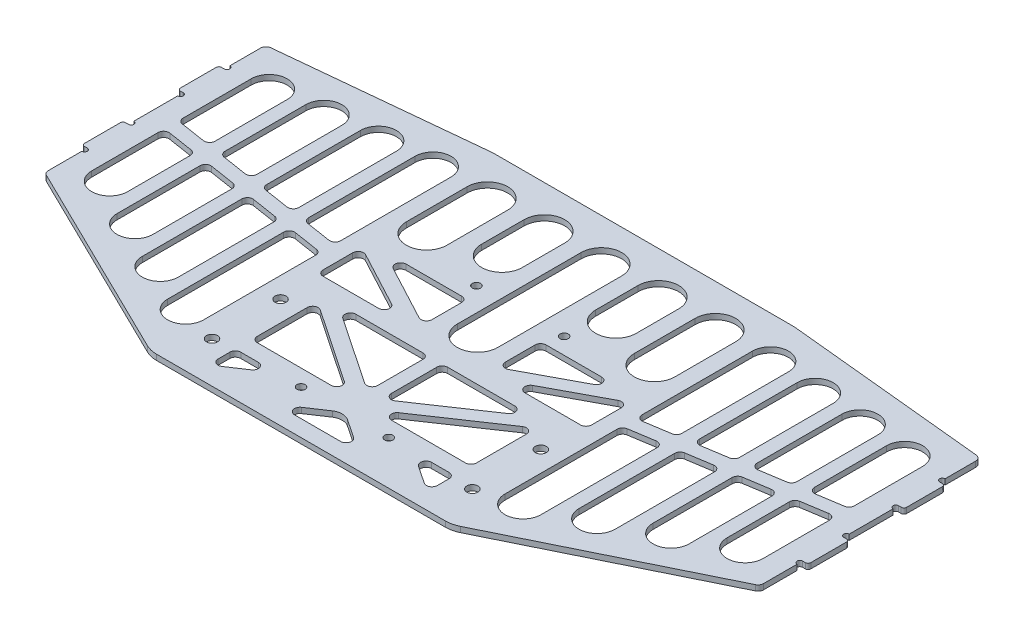
from build123d import *

# Parameters (mm, degrees)
SKETCH_1_R          = 2
SKETCH_1_R_2        = 1.5
EXTRUDE_1_DEPTH     = 2
SKETCH_3_R          = 1
CUT_EXTRUDE_1_DEPTH = 3
SKETCH_4_W          = 80
SKETCH_4_H          = 27
SKETCH_4_W_2        = 35.6
SKETCH_4_H_2        = 19
CUT_EXTRUDE_2_DEPTH = 183.168191515
EXTRUDE_START       = -2
EXTRUDE_2_DEPTH     = 2
FILLET_1_R          = 2
FILLET_2_R          = 5
FILLET_3_R          = 10
FILLET_4_R          = 1
FILLET_5_R          = 30


# Read off the part's stored shape, not the designer's step: 拉伸-薄壁2
with BuildPart() as part:
    # 草图1 → 凸台-拉伸1 (new body)
    with BuildSketch(Plane(origin=(0, 0, 0), x_dir=(1, 0, 0), z_dir=(0, 1, 0))):
        Polygon((-55, 0), (55, 0), (130.5, 37), (130.5, 52.5), (132.5, 52.5), (132.5, 67.5), (130.5, 67.5), (130.5, 87.5), (132.5, 87.5), (132.5, 102.5), (130.5, 102.5), (130.5, 117.5), (55, 125), (-55, 125), (-130.5, 117.5), (-130.5, 102.5), (-132.5, 102.5), (-132.5, 87.5), (-130.5, 87.5), (-130.5, 67.5), (-132.5, 67.5), (-132.5, 52.5), (-130.5, 52.5), (-130.5, 37), align=None)
        with Locations(Location((-47.5, 40, 0), (0, 0, 270))):
            Circle(SKETCH_1_R, mode=Mode.SUBTRACT)
        with Locations(Location((-47.5, 15, 0), (0, 0, 270))):
            Circle(SKETCH_1_R, mode=Mode.SUBTRACT)
        with Locations(Location((47.5, 40, 0), (0, 0, 90))):
            Circle(SKETCH_1_R, mode=Mode.SUBTRACT)
        with Locations(Location((47.5, 15, 0), (0, 0, 90))):
            Circle(SKETCH_1_R, mode=Mode.SUBTRACT)
        with Locations(Location((-16, 80, 0), (0, 0, 270))):
            Circle(SKETCH_1_R_2, mode=Mode.SUBTRACT)
        with Locations(Location((-16, 16, 0), (0, 0, 270))):
            Circle(SKETCH_1_R_2, mode=Mode.SUBTRACT)
        with Locations(Location((16, 16, 0), (0, 0, 90))):
            Circle(SKETCH_1_R_2, mode=Mode.SUBTRACT)
        with Locations(Location((16, 80, 0), (0, 0, 90))):
            Circle(SKETCH_1_R_2, mode=Mode.SUBTRACT)
    extrude(amount=EXTRUDE_1_DEPTH)

    # 草图3 → 切除-拉伸1 (cut)
    with BuildSketch(Plane(origin=(0, 2, 0), x_dir=(1, 0, 0), z_dir=(0, 1, 0))):
        with Locations((-130.5, 86.5)):
            Circle(SKETCH_3_R)
        with Locations((-130.5, 103.5)):
            Circle(SKETCH_3_R)
        with Locations((-130.5, 68.5)):
            Circle(SKETCH_3_R)
        with Locations((-130.5, 51.5)):
            Circle(SKETCH_3_R)
        with Locations((130.5, 51.5)):
            Circle(SKETCH_3_R)
        with Locations((130.5, 68.5)):
            Circle(SKETCH_3_R)
        with Locations((130.5, 103.5)):
            Circle(SKETCH_3_R)
        with Locations((130.5, 86.5)):
            Circle(SKETCH_3_R)
    extrude(amount=-CUT_EXTRUDE_1_DEPTH, mode=Mode.SUBTRACT)

    # 草图4 → 切除-拉伸2 (cut, through all)
    with BuildSketch(Plane(origin=(0, 2, 0), x_dir=(1, 0, 0), z_dir=(0, 1, 0))):
        Polygon((0, 16), (-15, 6), (15, 6), align=None)
        Polygon((-40, 16), (-40, 6), (-25, 16), align=None)
        with Locations((0, 35.5)):
            Rectangle(SKETCH_4_W, SKETCH_4_H)
        Polygon((25, 16), (40, 16), (40, 6), align=None)
        with BuildLine():
            Line((-91.25, 106.112927747), (-91.25, 37.19815221))
            ThreePointArc((-91.25, 37.19815221), (-97.8125, 30.63565221), (-104.375, 37.19815221))
            Line((-104.375, 37.19815221), (-104.375, 106.112927747))
            ThreePointArc((-104.375, 106.112927747), (-97.8125, 112.675427747), (-91.25, 106.112927747))
        make_face()
        with BuildLine():
            Line((-73.125, 107.913424436), (-73.125, 28.315701878))
            ThreePointArc((-73.125, 28.315701878), (-79.6875, 21.753201878), (-86.25, 28.315701878))
            Line((-86.25, 28.315701878), (-86.25, 107.913424436))
            ThreePointArc((-86.25, 107.913424436), (-79.6875, 114.475924436), (-73.125, 107.913424436))
        make_face()
        with BuildLine():
            Line((-55, 109.713921125), (-55, 19.433251547))
            ThreePointArc((-55, 19.433251547), (-61.5625, 12.870751547), (-68.125, 19.433251547))
            Line((-68.125, 19.433251547), (-68.125, 109.713921125))
            ThreePointArc((-68.125, 109.713921125), (-61.5625, 116.276421125), (-55, 109.713921125))
        make_face()
        with BuildLine():
            Line((-109.375, 104.312431059), (-109.375, 46.080602541))
            ThreePointArc((-109.375, 46.080602541), (-115.9375, 39.518102541), (-122.5, 46.080602541))
            Line((-122.5, 46.080602541), (-122.5, 104.312431059))
            ThreePointArc((-122.5, 104.312431059), (-115.9375, 110.874931059), (-109.375, 104.312431059))
        make_face()
        with Locations((-31.2, 64.5)):
            Rectangle(SKETCH_4_W_2, SKETCH_4_H_2)
        with BuildLine():
            Line((-34.2, 109.6), (-34.2, 87.4))
            ThreePointArc((-34.2, 87.4), (-41.6, 80), (-49, 87.4))
            Line((-49, 87.4), (-49, 109.6))
            ThreePointArc((-49, 109.6), (-41.6, 117), (-34.2, 109.6))
        make_face()
        with BuildLine():
            Line((-13.4, 109.6), (-13.4, 94.105672618))
            ThreePointArc((-13.4, 94.105672618), (-20.8, 86.705672618), (-28.2, 94.105672618))
            Line((-28.2, 94.105672618), (-28.2, 109.6))
            ThreePointArc((-28.2, 109.6), (-20.8, 117), (-13.4, 109.6))
        make_face()
        with BuildLine():
            Line((7.4, 109.6), (7.4, 64.4))
            ThreePointArc((7.4, 64.4), (0, 57), (-7.4, 64.4))
            Line((-7.4, 64.4), (-7.4, 109.6))
            ThreePointArc((-7.4, 109.6), (0, 117), (7.4, 109.6))
        make_face()
        with Locations((31.2, 64.5)):
            Rectangle(SKETCH_4_W_2, SKETCH_4_H_2)
        with BuildLine():
            Line((13.4, 109.6), (13.4, 94.105672618))
            ThreePointArc((13.4, 94.105672618), (20.8, 86.705672618), (28.2, 94.105672618))
            Line((28.2, 94.105672618), (28.2, 109.6))
            ThreePointArc((28.2, 109.6), (20.8, 117), (13.4, 109.6))
        make_face()
        with BuildLine():
            Line((34.2, 109.6), (34.2, 87.4))
            ThreePointArc((34.2, 87.4), (41.6, 80), (49, 87.4))
            Line((49, 87.4), (49, 109.6))
            ThreePointArc((49, 109.6), (41.6, 117), (34.2, 109.6))
        make_face()
        with BuildLine():
            Line((109.375, 104.312431059), (109.375, 46.080602541))
            ThreePointArc((109.375, 46.080602541), (115.9375, 39.518102541), (122.5, 46.080602541))
            Line((122.5, 46.080602541), (122.5, 104.312431059))
            ThreePointArc((122.5, 104.312431059), (115.9375, 110.874931059), (109.375, 104.312431059))
        make_face()
        with BuildLine():
            Line((55, 109.713921125), (55, 19.433251547))
            ThreePointArc((55, 19.433251547), (61.5625, 12.870751547), (68.125, 19.433251547))
            Line((68.125, 19.433251547), (68.125, 109.713921125))
            ThreePointArc((68.125, 109.713921125), (61.5625, 116.276421125), (55, 109.713921125))
        make_face()
        with BuildLine():
            Line((73.125, 107.913424436), (73.125, 28.315701878))
            ThreePointArc((73.125, 28.315701878), (79.6875, 21.753201878), (86.25, 28.315701878))
            Line((86.25, 28.315701878), (86.25, 107.913424436))
            ThreePointArc((86.25, 107.913424436), (79.6875, 114.475924436), (73.125, 107.913424436))
        make_face()
        with BuildLine():
            Line((91.25, 106.112927747), (91.25, 37.19815221))
            ThreePointArc((91.25, 37.19815221), (97.8125, 30.63565221), (104.375, 37.19815221))
            Line((104.375, 37.19815221), (104.375, 106.112927747))
            ThreePointArc((104.375, 106.112927747), (97.8125, 112.675427747), (91.25, 106.112927747))
        make_face()
    extrude(amount=-CUT_EXTRUDE_2_DEPTH, mode=Mode.SUBTRACT)

    # 拉伸-薄壁2 outline → 拉伸-薄壁2 (add)
    with BuildSketch(Plane(origin=(0, 2, 0), x_dir=(1, 0, 0), z_dir=(0, 1, 0)).offset(EXTRUDE_START)):
        Polygon((13.4, 55), (18.709597749, 55), (49, 71.166225921), (49, 74), (43.690402251, 74), (13.4, 57.833774079), align=None)
        Polygon((-13.4, 55), (-13.4, 57.833774079), (-43.690402251, 74), (-49, 74), (-49, 71.166225921), (-18.709597749, 55), align=None)
        Polygon((-104.375, 74.874833192), (-104.375, 69.813293306), (-91.25, 67.747723494), (-91.25, 72.80926338), align=None)
        Polygon((-122.5, 77.727286743), (-122.5, 72.665746857), (-109.375, 70.600177044), (-109.375, 75.66171693), align=None)
        Polygon((-68.125, 69.169926091), (-68.125, 64.108386205), (-55, 62.042816393), (-55, 67.104356279), align=None)
        Polygon((-86.25, 72.022379642), (-86.25, 66.960839756), (-73.125, 64.895269943), (-73.125, 69.956809829), align=None)
        Polygon((122.5, 72.665746857), (122.5, 77.727286743), (109.375, 75.66171693), (109.375, 70.600177044), align=None)
        Polygon((68.125, 64.108386205), (68.125, 69.169926091), (55, 67.104356279), (55, 62.042816393), align=None)
        Polygon((86.25, 66.960839756), (86.25, 72.022379642), (73.125, 69.956809829), (73.125, 64.895269943), align=None)
        Polygon((104.375, 69.813293306), (104.375, 74.874833192), (91.25, 72.80926338), (91.25, 67.747723494), align=None)
        Polygon((35.531507959, 49), (2.5, 26.703732128), (2.5, 49), (-2.5, 49), (-2.5, 26.703732128), (-35.531507959, 49), (-40, 49), (-40, 45.983767872), (-4.468492041, 22), (4.468492041, 22), (40, 45.983767872), (40, 49), align=None)
    extrude(amount=EXTRUDE_2_DEPTH)

    # 圆角1
    fillet_1_edges = [part.edges().sort_by_distance(p)[0] for p in [
        (13.4, 1, -74),
        (49, 1, -55),
        (-40, 1, -16),
        (-25, 1, -16),
        (-40, 1, -6),
        (15, 1, -6),
        (-15, 1, -6),
        (-49, 1, -55),
        (-13.4, 1, -74),
        (40, 1, -6),
        (25, 1, -16),
        (40, 1, -16),
        (-40, 1, -22),
        (40, 1, -22),
        (130.5, 1, -117.5),
        (130.5, 1, -37),
        (-130.5, 1, -37),
        (-130.5, 1, -117.5),
        (13.4, 1, -57.833774079),
        (18.709597749, 1, -55),
        (49, 1, -71.166225921),
        (43.690402251, 1, -74),
        (-18.709597749, 1, -55),
        (-13.4, 1, -57.833774079),
        (-43.690402251, 1, -74),
        (-49, 1, -71.166225921),
        (-104.375, 1, -69.813293306),
        (-104.375, 1, -74.874833192),
        (-73.125, 1, -69.956809829),
        (-86.25, 1, -72.022379642),
        (-55, 1, -67.104356279),
        (-68.125, 1, -69.169926091),
        (-109.375, 1, -75.66171693),
        (-122.5, 1, -77.727286743),
        (-91.25, 1, -72.80926338),
        (-73.125, 1, -64.895269943),
        (-68.125, 1, -64.108386205),
        (-55, 1, -62.042816393),
        (-109.375, 1, -70.600177044),
        (-86.25, 1, -66.960839756),
        (-91.25, 1, -67.747723494),
        (-122.5, 1, -72.665746857),
        (109.375, 1, -75.66171693),
        (109.375, 1, -70.600177044),
        (104.375, 1, -69.813293306),
        (91.25, 1, -67.747723494),
        (86.25, 1, -66.960839756),
        (73.125, 1, -64.895269943),
        (68.125, 1, -64.108386205),
        (55, 1, -62.042816393),
        (122.5, 1, -72.665746857),
        (104.375, 1, -74.874833192),
        (91.25, 1, -72.80926338),
        (86.25, 1, -72.022379642),
        (73.125, 1, -69.956809829),
        (68.125, 1, -69.169926091),
        (122.5, 1, -77.727286743),
        (55, 1, -67.104356279),
        (-4.468492041, 1, -22),
        (4.468492041, 1, -22),
        (-35.531507959, 1, -49),
        (35.531507959, 1, -49),
        (-2.5, 1, -26.703732128),
        (40, 1, -45.983767872),
        (-40, 1, -45.983767872),
        (2.5, 1, -26.703732128),
        (2.5, 1, -49),
        (-2.5, 1, -49),
    ]]
    fillet(fillet_1_edges, radius=FILLET_1_R)

    # 圆角2
    fillet_2_edges = [part.edges().sort_by_distance(p)[0] for p in [
        (0, 1, -16),
    ]]
    fillet(fillet_2_edges, radius=FILLET_2_R)

    # 圆角3
    fillet_3_edges = [part.edges().sort_by_distance(p)[0] for p in [
        (55, 1, 0),
        (-55, 1, 0),
    ]]
    fillet(fillet_3_edges, radius=FILLET_3_R)

    # 圆角4
    fillet_4_edges = [part.edges().sort_by_distance(p)[0] for p in [
        (132.5, 1, -102.5),
        (132.5, 1, -87.5),
        (132.5, 1, -67.5),
        (132.5, 1, -52.5),
        (-132.5, 1, -52.5),
        (-132.5, 1, -67.5),
        (-132.5, 1, -87.5),
        (-132.5, 1, -102.5),
    ]]
    fillet(fillet_4_edges, radius=FILLET_4_R)

    # 圆角5
    # the kernel refuses this fillet: 30 mm, written as the material it takes off along each edge
    with BuildSketch(Plane(origin=(-55, -3.716020656, -125), x_dir=(-0.9951022246073864, 0, 0.09885121436497732), z_dir=(0, 1, 0)), Plane(origin=(55, -3.716020656, -125), x_dir=(-1, 0, 0), z_dir=(0, 1, 0))) as fillet_5_piece_1:
        with BuildLine():
            CenterArc((FILLET_5_R * 0.0495469420793, FILLET_5_R), FILLET_5_R, 264.32697786, 5.67302214)
            Line((-FILLET_5_R * 0.0493042722856, FILLET_5_R * 0.00489777539261), (0, 0))
            Line((0, 0), (FILLET_5_R * 0.0495469420793, 0))
        make_face()
    extrude(amount=9.432041312, mode=Mode.SUBTRACT)


solid = part.part
